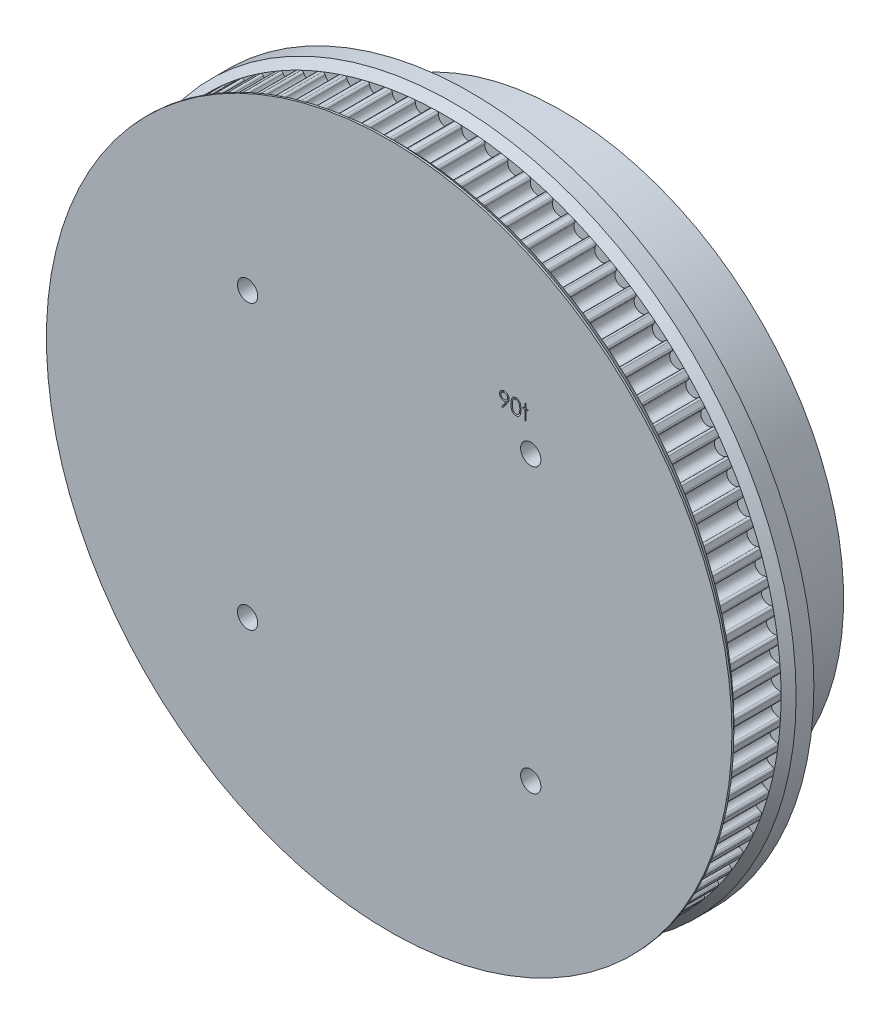
from build123d import *

# Parameters (mm, degrees)
SKETCH1_R           = 71.029724391
BOSS_EXTRUDE1_DEPTH = 10
CUT_EXTRUDE1_DEPTH  = 101.947726543
CIRPATTERN3_COUNT   = 90
CUT_EXTRUDE5_DEPTH  = 1
SKETCH10_R          = 72.629724391
BOSS_EXTRUDE3_DEPTH = 3.365
SKETCH11_R          = 59.75
BOSS_EXTRUDE4_DEPTH = 19.175
SKETCH12_R          = 2.15
CUT_EXTRUDE6_DEPTH  = 110.019839293


with BuildPart() as part:
    # Sketch1 → Boss-Extrude1 (new body)
    with BuildSketch(Plane.XY):
        Circle(SKETCH1_R)
    extrude(amount=BOSS_EXTRUDE1_DEPTH)

    # Sketch1<5> → Cut-Extrude1 (cut, through all)
    with BuildSketch(Plane.XY):
        with BuildLine():
            ThreePointArc((3.523854408, 70.9422596), (3.258115698, 70.954960568), (2.992331281, 70.966666123))
            ThreePointArc((2.992331281, 70.966666123), (3.300458942, 70.817165102), (3.401631166, 70.489968843))
            ThreePointArc((3.401631166, 70.489968843), (6.389656914, 69.925169615), (3.523854408, 70.9422596))
        make_face()
        with BuildLine():
            ThreePointArc((1.433411393, 71.015259479), (-1.496358772, 70.200555347), (1.523786697, 70.555544627))
            ThreePointArc((1.523786697, 70.555544627), (1.647536515, 70.874886412), (1.965342224, 71.002529371))
            ThreePointArc((1.965342224, 71.002529371), (1.699388729, 71.009392513), (1.433411393, 71.015259479))
        make_face()
    cut_extrude1 = extrude(amount=CUT_EXTRUDE1_DEPTH, mode=Mode.SUBTRACT)

    # CirPattern3: Cut-Extrude1 ×90 about axis
    cirpattern3_axis = Axis((0, 0, 10), (0, 0, 1))
    for i in range(1, CIRPATTERN3_COUNT):
        add(cut_extrude1.rotate(cirpattern3_axis, i * 360 / CIRPATTERN3_COUNT), mode=Mode.SUBTRACT)

    # Sketch5 → Revolve1 (revolve)
    with BuildSketch(Plane(origin=(0, 0, 0), x_dir=(0, 0, -1), z_dir=(1, 0, 0))):
        Polygon((0, 71.029724391), (0, 0), (2, 0), (2, 72.629724391), (1.6, 72.629724391), align=None)
    revolve1 = revolve(axis=Axis((0, 0, -1.6), (0, 0, -1)))

    # Mirror1: Revolve1 across plane
    add(revolve1.mirror(Plane.XY.offset(5)))

    # Sketch9 → Cut-Extrude5 (cut)
    # profile 1 of 3: a face of its own
    with BuildSketch(Plane.XY.offset(12)):
        with BuildLine():
            Line((24.056835363, 35.413500522), (23.829141052, 35.571868912))
            Line((23.829141052, 35.571868912), (24.71193352, 36.862348679))
            add(Edge.make_bspline(
                [(24.71193352, 36.862348679), (24.655608353, 36.855460686), (24.544700958, 36.841897844), (24.432998015, 36.839406235), (24.378024265, 36.838180009)],
                knots=[0, 0, 0, 0, 1.015715272, 2, 2, 2, 2], degree=3))
            add(Edge.make_bspline(
                [(24.378024265, 36.838180009), (24.344693979, 36.8390337), (24.279269542, 36.840709421), (24.183083686, 36.853991632), (24.090658927, 36.87444782), (24.002240297, 36.904972048), (23.91749546, 36.942907137), (23.83660942, 36.989948857), (23.759691063, 37.045290278), (23.687566484, 37.108638778), (23.621969406, 37.178196725), (23.563528272, 37.251816487), (23.514958816, 37.330353261), (23.4746122, 37.41220496), (23.44401386, 37.498548042), (23.421732129, 37.588399998), (23.408013993, 37.682390559), (23.406381957, 37.746366928), (23.405553312, 37.778850082)],
                knots=[0, 0, 0, 0, 1.060718605, 2.082097864, 3.085795603, 4.069760067, 5.054557537, 6.03741023, 7.043284206, 8.066802108, 9.088538119, 10.083643548, 11.053783639, 12.022749082, 12.983451788, 13.964007469, 14.966251758, 16, 16, 16, 16], degree=3))
            add(Edge.make_bspline(
                [(23.405553312, 37.778850082), (23.407126692, 37.823271645), (23.410214918, 37.910462163), (23.435069287, 38.037855654), (23.475945452, 38.158312018), (23.532939765, 38.271514551), (23.604726262, 38.375834836), (23.691003341, 38.469822646), (23.791246222, 38.552141192), (23.90317134, 38.622902033), (24.02414158, 38.679811638), (24.150841006, 38.721757289), (24.282298815, 38.746430439), (24.371350915, 38.749683327), (24.416185323, 38.751321035)],
                knots=[0, 0, 0, 0, 1.022988612, 2.007919123, 2.978103895, 3.94594894, 4.918897164, 5.887013414, 6.875921846, 7.89917871, 8.930658928, 9.948724884, 10.967259574, 12, 12, 12, 12], degree=3))
            add(Edge.make_bspline(
                [(24.416185323, 38.751321035), (24.460171246, 38.749660816), (24.547083285, 38.746380379), (24.674889741, 38.722355635), (24.797300521, 38.681863797), (24.913637045, 38.625907085), (25.021350654, 38.555765976), (25.118211569, 38.472186801), (25.202009379, 38.375117501), (25.272606757, 38.2669058), (25.329276007, 38.150640038), (25.370163007, 38.029278908), (25.395332265, 37.903695211), (25.398503933, 37.818610224), (25.400104594, 37.775669993)],
                knots=[0, 0, 0, 0, 1.026385292, 2.028040595, 3.023318987, 4.028184125, 5.03290303, 6.015178782, 7.004435299, 8.016004309, 9.023023918, 10.015172535, 10.998308025, 12, 12, 12, 12], degree=3))
            add(Edge.make_bspline(
                [(25.400104594, 37.775669993), (25.399035608, 37.742338148), (25.396867439, 37.674732836), (25.381685218, 37.572016739), (25.35590405, 37.467285981), (25.326647152, 37.378638533), (25.298405828, 37.305424439), (25.271825516, 37.247592649), (25.242332348, 37.186722217), (25.207934611, 37.123451418), (25.170957384, 37.05697369), (25.129175041, 36.987955798), (25.083540701, 36.916305125), (25.051038026, 36.86800241), (25.034394457, 36.843268151)],
                knots=[0, 0, 0, 0, 1.179839688, 2.393009684, 3.667231171, 4.993948276, 5.694988576, 6.444077775, 7.246288328, 8.089075292, 8.993003841, 9.939041771, 10.944649915, 12, 12, 12, 12], degree=3))
            Line((25.034394457, 36.843268151), (24.056835363, 35.413500522))
        make_face()
        with BuildLine():
            add(Edge.make_bspline(
                [(24.430813728, 37.163821035), (24.456063155, 37.164510812), (24.505215206, 37.165853573), (24.577221756, 37.174026242), (24.645188712, 37.188516929), (24.709297631, 37.209308382), (24.770191321, 37.234396932), (24.826902561, 37.266339234), (24.879478815, 37.304454324), (24.928272149, 37.347280553), (24.97160092, 37.394860725), (25.010193527, 37.444660243), (25.042996327, 37.496897711), (25.0689073, 37.552227313), (25.090211165, 37.609302209), (25.104923218, 37.669041517), (25.113073292, 37.731133995), (25.114462649, 37.77331492), (25.115168696, 37.794750522)],
                knots=[0, 0, 0, 0, 1.163407946, 2.26475976, 3.333800367, 4.359385343, 5.366239384, 6.363380779, 7.350133999, 8.353570782, 9.349036268, 10.310270964, 11.253520213, 12.184142, 13.120487599, 14.056272588, 15.012232024, 16, 16, 16, 16], degree=3))
            add(Edge.make_bspline(
                [(25.115168696, 37.794750522), (25.114561211, 37.816195076), (25.113364086, 37.858454199), (25.103759892, 37.920638606), (25.086864154, 37.980231778), (25.064194215, 38.037559968), (25.034330856, 38.092152162), (24.998495551, 38.14469376), (24.955921115, 38.194851619), (24.906933072, 38.24144609), (24.854106014, 38.284397399), (24.797808274, 38.322303339), (24.738503886, 38.354072567), (24.676554656, 38.380288061), (24.611831511, 38.400745743), (24.54437275, 38.41545721), (24.473837489, 38.423595873), (24.425957323, 38.424976449), (24.401556917, 38.425680009)],
                knots=[0, 0, 0, 0, 0.972161553, 1.915763587, 2.844109794, 3.775983486, 4.705125789, 5.659731448, 6.655561913, 7.682237399, 8.721216875, 9.739758359, 10.754845918, 11.767244016, 12.7857855, 13.828538656, 14.893392813, 16, 16, 16, 16], degree=3))
            add(Edge.make_bspline(
                [(24.401556917, 38.425680009), (24.377368721, 38.424975312), (24.329911679, 38.423592702), (24.260003478, 38.41547268), (24.193000847, 38.400646805), (24.128465234, 38.380297537), (24.066517845, 38.354070611), (24.007216254, 38.322301674), (23.950905346, 38.284406124), (23.898128935, 38.241412295), (23.849054391, 38.195068502), (23.807211947, 38.144474034), (23.77129463, 38.092179494), (23.741472306, 38.037552704), (23.718791452, 37.980233717), (23.701898636, 37.920638081), (23.692293657, 37.858454336), (23.69109664, 37.816195122), (23.690489209, 37.794750522)],
                knots=[0, 0, 0, 0, 1.099389452, 2.15699305, 3.192601482, 4.213358962, 5.227959689, 6.245255729, 7.266013209, 8.307253147, 9.336162325, 10.327954924, 11.284637477, 12.215801273, 13.149702402, 14.080068371, 15.025723358, 16, 16, 16, 16], degree=3))
            add(Edge.make_bspline(
                [(23.690489209, 37.794750522), (23.691038871, 37.773298228), (23.692122904, 37.730990376), (23.702580256, 37.668827149), (23.72006841, 37.609238573), (23.743490286, 37.551645246), (23.774334585, 37.496607203), (23.812184076, 37.444385382), (23.856548393, 37.394387795), (23.906834485, 37.347391253), (23.961869174, 37.304254636), (24.020649079, 37.266580647), (24.082162288, 37.234764929), (24.146625339, 37.209236674), (24.213560508, 37.188724665), (24.283569377, 37.174052949), (24.356420421, 37.165931964), (24.405778047, 37.164531429), (24.430813728, 37.163821035)],
                knots=[0, 0, 0, 0, 0.952633368, 1.87876736, 2.791047057, 3.707742249, 4.635551637, 5.587206343, 6.568248508, 7.601284464, 8.641511608, 9.671105535, 10.699146789, 11.713763218, 12.747829548, 13.806491675, 14.887386225, 16, 16, 16, 16], degree=3))
        make_face(mode=Mode.SUBTRACT)
    # profile 2 of 3: a face of its own
    with BuildSketch(Plane.XY.offset(12)):
        with BuildLine():
            add(Edge.make_bspline(
                [(25.807155876, 37.081138743), (25.807453435, 37.132027088), (25.808031448, 37.230878431), (25.814461659, 37.374918785), (25.825143576, 37.510047047), (25.839782479, 37.636269685), (25.857596932, 37.753619286), (25.881378124, 37.861782244), (25.908422595, 37.961259173), (25.939766599, 38.05237446), (25.975134094, 38.136355662), (26.01362803, 38.214755666), (26.056776094, 38.287455848), (26.102112293, 38.355616557), (26.151471815, 38.418122052), (26.203450004, 38.475855039), (26.260075563, 38.52748122), (26.319423578, 38.574513222), (26.38203137, 38.615742386), (26.44611436, 38.652057799), (26.512113635, 38.683081964), (26.580209387, 38.707475431), (26.649789564, 38.727623842), (26.721097403, 38.741402387), (26.79425064, 38.750071869), (26.843627728, 38.750900696), (26.868669297, 38.751321035)],
                knots=[0, 0, 0, 0, 1.646270934, 3.197905019, 4.663502075, 6.030701355, 7.308322542, 8.50163776, 9.611534131, 10.641858119, 11.616356847, 12.558055219, 13.465016945, 14.349605745, 15.204443733, 16.039544428, 16.859896111, 17.680448484, 18.487036065, 19.28249412, 20.06191084, 20.843045899, 21.620316918, 22.403196591, 23.190181807, 24, 24, 24, 24], degree=3))
            add(Edge.make_bspline(
                [(26.868669297, 38.751321035), (26.893920053, 38.750878517), (26.944135861, 38.749998488), (27.018376773, 38.74154034), (27.090902555, 38.727505821), (27.16140401, 38.707620366), (27.230460247, 38.682950002), (27.297531132, 38.652028117), (27.36303327, 38.616033716), (27.425925745, 38.573739199), (27.486899003, 38.526583848), (27.54445537, 38.473277713), (27.598600083, 38.414359039), (27.650012682, 38.350458205), (27.697234545, 38.280349593), (27.74220473, 38.205252579), (27.782456505, 38.123853866), (27.821222961, 38.037511584), (27.854684727, 37.943836694), (27.884861964, 37.843357232), (27.909245028, 37.734886363), (27.929555297, 37.618993197), (27.945289595, 37.495252123), (27.956749206, 37.363928394), (27.962802648, 37.224935611), (27.963942655, 37.129905277), (27.964527671, 37.081138743)],
                knots=[0, 0, 0, 0, 0.810914788, 1.612654377, 2.396697861, 3.181598691, 3.963628158, 4.749916497, 5.551656086, 6.361998678, 7.18212741, 8.025565596, 8.878627764, 9.750805457, 10.657531673, 11.591944965, 12.560506719, 13.57287815, 14.630710178, 15.753379473, 16.941251878, 18.199788006, 19.531962791, 20.947069417, 22.433333509, 24, 24, 24, 24], degree=3))
            add(Edge.make_bspline(
                [(27.964527671, 37.081138743), (27.96393659, 37.032584913), (27.962784895, 36.937979754), (27.956817068, 36.799612369), (27.945061738, 36.668985572), (27.930356963, 36.545786081), (27.909990732, 36.43052667), (27.884948903, 36.322808492), (27.857144681, 36.22216637), (27.822823118, 36.129424791), (27.785257688, 36.043290013), (27.744386189, 35.962856243), (27.700598561, 35.887412535), (27.652893056, 35.817562764), (27.602044603, 35.752812125), (27.546964895, 35.694303568), (27.489206578, 35.640627315), (27.428053887, 35.592864767), (27.364180551, 35.551059266), (27.298903388, 35.513672416), (27.231064176, 35.483525614), (27.162200283, 35.457640256), (27.091326694, 35.437864131), (27.018531754, 35.424189991), (26.94418574, 35.414599814), (26.893928606, 35.413868222), (26.868669297, 35.413500522)],
                knots=[0, 0, 0, 0, 1.561518951, 3.042555995, 4.452378317, 5.7783523, 7.031515105, 8.214008947, 9.334062868, 10.386615937, 11.391082383, 12.354592575, 13.286541444, 14.194233754, 15.072674879, 15.931287219, 16.775624067, 17.606195743, 18.42308326, 19.229000347, 20.022332153, 20.807536673, 21.593273796, 22.3848459, 23.188221202, 24, 24, 24, 24], degree=3))
            add(Edge.make_bspline(
                [(26.868669297, 35.413500522), (26.843628422, 35.413923573), (26.794252705, 35.414757747), (26.721089433, 35.423388061), (26.650076074, 35.437263267), (26.580862204, 35.456691187), (26.513092723, 35.480471788), (26.447691091, 35.511454058), (26.383930121, 35.547135678), (26.321979924, 35.587771525), (26.263004606, 35.634327623), (26.2066723, 35.685820942), (26.154398175, 35.743536465), (26.105744389, 35.806562867), (26.059503609, 35.874320308), (26.016968249, 35.947733904), (25.977624688, 36.026512557), (25.941662379, 36.111165234), (25.90977752, 36.202927204), (25.881612813, 36.302848244), (25.85937497, 36.411810286), (25.840340432, 36.528938183), (25.824987599, 36.654735248), (25.814506175, 36.789269776), (25.808027982, 36.93245793), (25.807451883, 37.030674082), (25.807155876, 37.081138743)],
                knots=[0, 0, 0, 0, 0.810891512, 1.598919785, 2.382837074, 3.152667961, 3.926044502, 4.706494248, 5.493654104, 6.291793342, 7.103789334, 7.925228297, 8.761435821, 9.622817696, 10.50288917, 11.416980706, 12.369136599, 13.353924996, 14.394355917, 15.514179734, 16.714354668, 17.994756427, 19.357759367, 20.818452758, 22.365282078, 24, 24, 24, 24], degree=3))
        make_face()
        with BuildLine():
            add(Edge.make_bspline(
                [(26.092091773, 37.082410779), (26.092200129, 37.040003031), (26.092410426, 36.957697918), (26.097904265, 36.838097246), (26.105388404, 36.726545591), (26.11504158, 36.622901311), (26.129377112, 36.527515228), (26.145439698, 36.439731302), (26.164986894, 36.360014094), (26.188114517, 36.28781658), (26.214457127, 36.221913496), (26.243218874, 36.160589537), (26.274116816, 36.10312028), (26.308696331, 36.050021935), (26.346356424, 36.001121343), (26.386246452, 35.955552988), (26.429855154, 35.914915727), (26.490183549, 35.866177794), (26.569827493, 35.815814008), (26.670176049, 35.771957198), (26.773289572, 35.74439597), (26.843276778, 35.740890991), (26.878209562, 35.739141548)],
                knots=[0, 0, 0, 0, 1.459021318, 2.831673884, 4.118529203, 5.306027144, 6.411944654, 7.436330062, 8.375795394, 9.233974572, 10.042671642, 10.816086306, 11.563610507, 12.285937304, 12.993564865, 13.685989202, 14.367179055, 15.041617293, 16.353048772, 17.594441528, 18.799311195, 20, 20, 20, 20], degree=3))
            add(Edge.make_bspline(
                [(26.878209562, 35.739141548), (26.913368307, 35.740590963), (26.983613207, 35.743486802), (27.086241721, 35.771425656), (27.185873466, 35.813580167), (27.263953012, 35.863425404), (27.323355034, 35.910894675), (27.365915446, 35.951366534), (27.404978876, 35.996683642), (27.442028472, 36.045578004), (27.476009205, 36.098983757), (27.506909337, 36.156644093), (27.535106374, 36.218719133), (27.551171008, 36.262053111), (27.559384441, 36.284208655)],
                knots=[0, 0, 0, 0, 1.353760809, 2.704726607, 4.075137775, 5.516104923, 6.260822281, 7.007110065, 7.778089737, 8.566572457, 9.372053459, 10.217411131, 11.088608312, 12, 12, 12, 12], degree=3))
            add(Edge.make_bspline(
                [(27.559384441, 36.284208655), (27.568956402, 36.31253849), (27.588391588, 36.370060205), (27.613439411, 36.45929009), (27.633165595, 36.55290974), (27.650912363, 36.650359667), (27.663025492, 36.752358539), (27.672775294, 36.858590758), (27.678518131, 36.969136423), (27.679230013, 37.044243307), (27.679591773, 37.082410779)],
                knots=[0, 0, 0, 0, 0.884706709, 1.796334032, 2.740027952, 3.714592787, 4.726048262, 5.777819803, 6.87074269, 8, 8, 8, 8], degree=3))
            add(Edge.make_bspline(
                [(27.679591773, 37.082410779), (27.679092673, 37.120572077), (27.678116326, 37.195223733), (27.674384352, 37.30455094), (27.664747252, 37.408389552), (27.654043766, 37.507186909), (27.638262001, 37.600396112), (27.62124599, 37.688797461), (27.59838489, 37.771295776), (27.573964809, 37.849182682), (27.546015379, 37.921573276), (27.515248963, 37.988805068), (27.482390653, 38.05120264), (27.44670162, 38.108594794), (27.408605536, 38.1612386), (27.367096903, 38.208078554), (27.323822222, 38.250566375), (27.263209489, 38.299064563), (27.183857811, 38.348514458), (27.08511926, 38.394021969), (26.982366604, 38.420155206), (26.912903542, 38.423839736), (26.878209562, 38.425680009)],
                knots=[0, 0, 0, 0, 1.31362396, 2.569729283, 3.763502607, 4.902122613, 5.988968491, 7.01645872, 7.998833611, 8.933434873, 9.825090667, 10.667526885, 11.477055099, 12.250526234, 12.991942729, 13.710640831, 14.402115721, 15.076753259, 16.378508321, 17.609869233, 18.806226677, 20, 20, 20, 20], degree=3))
            add(Edge.make_bspline(
                [(26.878209562, 38.425680009), (26.843093525, 38.423837197), (26.772797477, 38.420148215), (26.668976833, 38.394119335), (26.569459314, 38.348750431), (26.490317472, 38.298900778), (26.429662466, 38.251422453), (26.386951737, 38.210250455), (26.346904852, 38.16521421), (26.310013439, 38.115863902), (26.275461017, 38.062827462), (26.243728242, 38.005687654), (26.215137521, 37.944154916), (26.188753692, 37.878281435), (26.16555552, 37.80609015), (26.146420282, 37.726471134), (26.128742741, 37.638966418), (26.116228461, 37.543063722), (26.105103483, 37.439393483), (26.097953974, 37.327563344), (26.092392048, 37.207762085), (26.092193869, 37.125031419), (26.092091773, 37.082410779)],
                knots=[0, 0, 0, 0, 1.207732386, 2.417664972, 3.655092373, 4.956220595, 5.625982001, 6.301752483, 6.994047911, 7.697131622, 8.419323945, 9.170223765, 9.943494443, 10.752040957, 11.610060368, 12.549350801, 13.567764191, 14.679664412, 15.874934091, 17.154273443, 18.533957287, 20, 20, 20, 20], degree=3))
        make_face(mode=Mode.SUBTRACT)
    # profile 3 of 3: a face of its own
    with BuildSketch(Plane.XY.offset(12)):
        Polygon((28.737925107, 38.751321035), (29.022861004, 38.751321035), (29.022861004, 37.815103086), (29.429912286, 37.815103086), (29.429912286, 37.530167189), (29.022861004, 37.530167189), (29.022861004, 35.494910779), (28.737925107, 35.494910779), (28.737925107, 37.530167189), (28.330873824, 37.530167189), (28.330873824, 37.815103086), (28.737925107, 37.815103086), align=None)
    extrude(amount=-CUT_EXTRUDE5_DEPTH, mode=Mode.SUBTRACT)

    # Sketch10 → Boss-Extrude3 (add)
    with BuildSketch(Plane(origin=(0, 0, -2), x_dir=(-1, 0, 0), z_dir=(0, 0, -1))):
        Circle(SKETCH10_R)
    extrude(amount=BOSS_EXTRUDE3_DEPTH)

    # Sketch11 → Boss-Extrude4 (add)
    with BuildSketch(Plane(origin=(0, 0, -5.365), x_dir=(-1, 0, 0), z_dir=(0, 0, -1))):
        Circle(SKETCH11_R)
    extrude(amount=BOSS_EXTRUDE4_DEPTH)

    # Sketch12 → Cut-Extrude6 (cut, through all)
    with BuildSketch(Plane.XY.offset(12)):
        with Locations((-30, 30)):
            Circle(SKETCH12_R)
        with Locations((30, 30)):
            Circle(SKETCH12_R)
        with Locations((30, -30)):
            Circle(SKETCH12_R)
        with Locations((-30, -30)):
            Circle(SKETCH12_R)
    extrude(amount=-CUT_EXTRUDE6_DEPTH, mode=Mode.SUBTRACT)


solid = part.part
